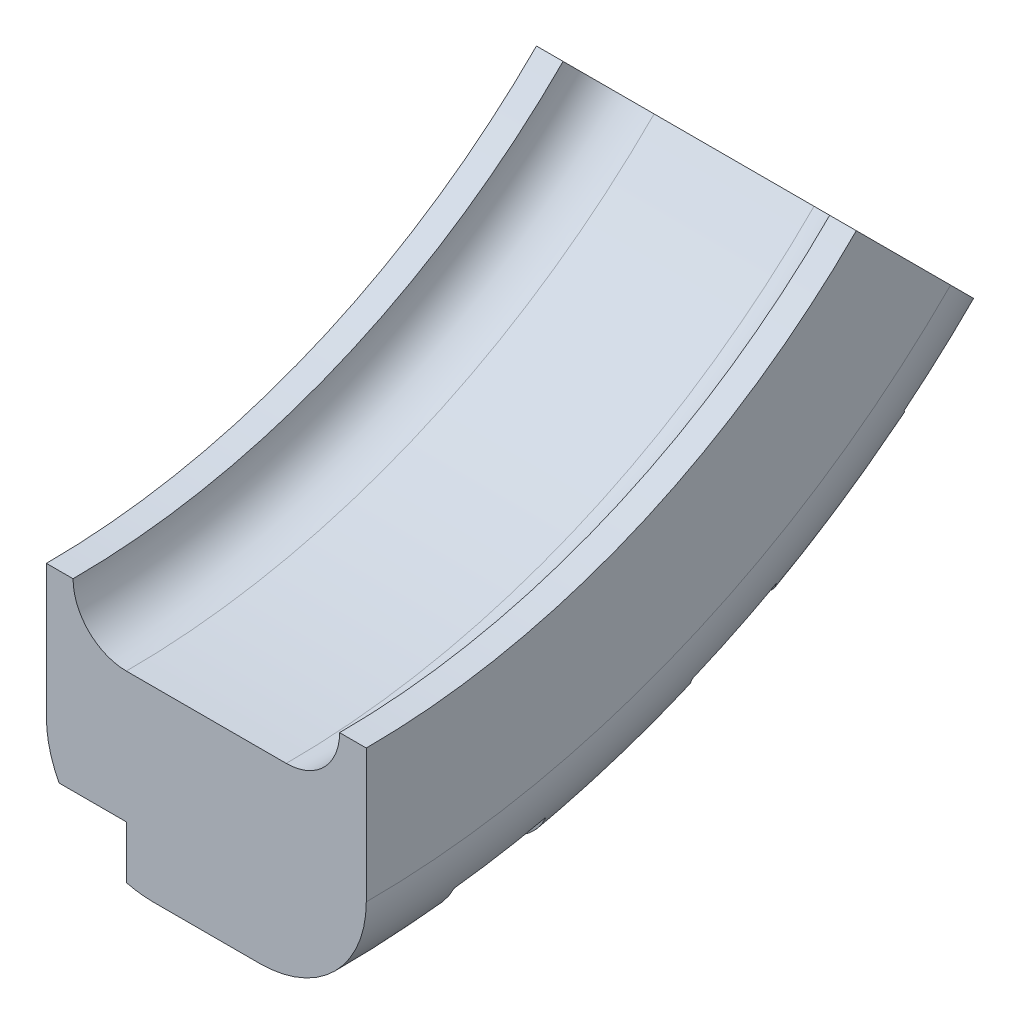
from build123d import *

# Parameters (mm, degrees)
REVOLVE1_ANGLE     = 45
CUT_EXTRUDE1_START = -3
CUT_EXTRUDE1_DEPTH = 3
CUT_EXTRUDE2_DEPTH = 3
FILLET1_R          = 2


with BuildPart() as part:
    # Sketch1 → Revolve1 (revolve)
    with BuildSketch(Plane.XY):
        with BuildLine():
            Line((-5, -28), (5, -28))
            Line((5, -28), (5, -26))
            Line((5, -26), (6, -26))
            Line((6, -26), (6, -31))
            ThreePointArc((6, -31), (4.828427125, -33.828427125), (2, -35))
            Line((2, -35), (-2, -35))
            ThreePointArc((-2, -35), (-4.828427125, -33.828427125), (-6, -31))
            Line((-6, -31), (-6, -26))
            Line((-6, -26), (-5, -26))
            Line((-5, -26), (-5, -28))
        make_face()
    revolve(axis=Axis((0.352941176, 0, 0), (1, 0, 0)), revolution_arc=REVOLVE1_ANGLE)

    # Sketch2 → Cut-Extrude1 (cut)
    with BuildSketch(Plane(origin=(6, 0, 0), x_dir=(0, 0, -1), z_dir=(1, 0, 0)).offset(CUT_EXTRUDE1_START)):
        with BuildLine():
            Line((21.979575266, -27.237809588), (20.66080075, -25.603541012))
            ThreePointArc((20.66080075, -25.603541012), (21.993442367, -24.468316101), (23.263813101, -23.263813101))
            Line((23.263813101, -23.263813101), (24.748737342, -24.748737342))
            ThreePointArc((24.748737342, -24.748737342), (23.397279114, -26.030123512), (21.979575266, -27.237809588))
        make_face()
        with BuildLine():
            Line((15.87243062, -28.817979565), (16.88556449, -30.657425069))
            ThreePointArc((16.88556449, -30.657425069), (15.230946014, -31.512192617), (13.533203573, -32.277738475))
            Line((13.533203573, -32.277738475), (12.721211358, -30.341074166))
            ThreePointArc((12.721211358, -30.341074166), (14.317089253, -29.62146106), (15.87243062, -28.817979565))
        make_face()
        with BuildLine():
            Line((7.227552694, -32.09630013), (7.688885845, -34.145000139))
            ThreePointArc((7.688885845, -34.145000139), (5.861777513, -34.505645399), (4.018072504, -34.768593491))
            Line((4.018072504, -34.768593491), (3.776988154, -32.682477882))
            ThreePointArc((3.776988154, -32.682477882), (5.510070862, -32.435306675), (7.227552694, -32.09630013))
        make_face()
    extrude(amount=CUT_EXTRUDE1_DEPTH, mode=Mode.SUBTRACT)

    # Sketch3 → Cut-Extrude2 (cut)
    with BuildSketch(Plane.ZY.offset(6)):
        with BuildLine():
            Line((0, -35), (0, -32.9))
            ThreePointArc((0, -32.9), (-1.752488008, -32.853291856), (-3.5, -32.713300048))
            Line((-3.5, -32.713300048), (-3.723404255, -34.801383029))
            ThreePointArc((-3.723404255, -34.801383029), (-1.864348945, -34.950310485), (0, -35))
        make_face()
        with BuildLine():
            Line((-12.636083101, -32.639384245), (-11.877918115, -30.68102119))
            ThreePointArc((-11.877918115, -30.68102119), (-10.226765616, -31.270165734), (-8.54657523, -31.770521743))
            Line((-8.54657523, -31.770521743), (-9.092101309, -33.798427386))
            ThreePointArc((-9.092101309, -33.798427386), (-10.879537889, -33.26613376), (-12.636083101, -32.639384245))
        make_face()
        with BuildLine():
            Line((-20.681152153, -28.236323161), (-19.440283023, -26.542143771))
            ThreePointArc((-19.440283023, -26.542143771), (-17.998860282, -27.539989625), (-16.506331561, -28.45963841))
            Line((-16.506331561, -28.45963841), (-17.559927193, -30.276211074))
            ThreePointArc((-17.559927193, -30.276211074), (-19.147723704, -29.297861303), (-20.681152153, -28.236323161))
        make_face()
    extrude(amount=-CUT_EXTRUDE2_DEPTH, mode=Mode.SUBTRACT)

    # Fillet1
    fillet1_edges = [part.edges().sort_by_distance(p)[0] for p in [
        (5, -25.86862691, -10.715136106),
        (-5, -25.86862691, -10.715136106),
    ]]
    fillet(fillet1_edges, radius=FILLET1_R - 0.0001)  # a hair under: the kernel refuses the full size


solid = part.part
